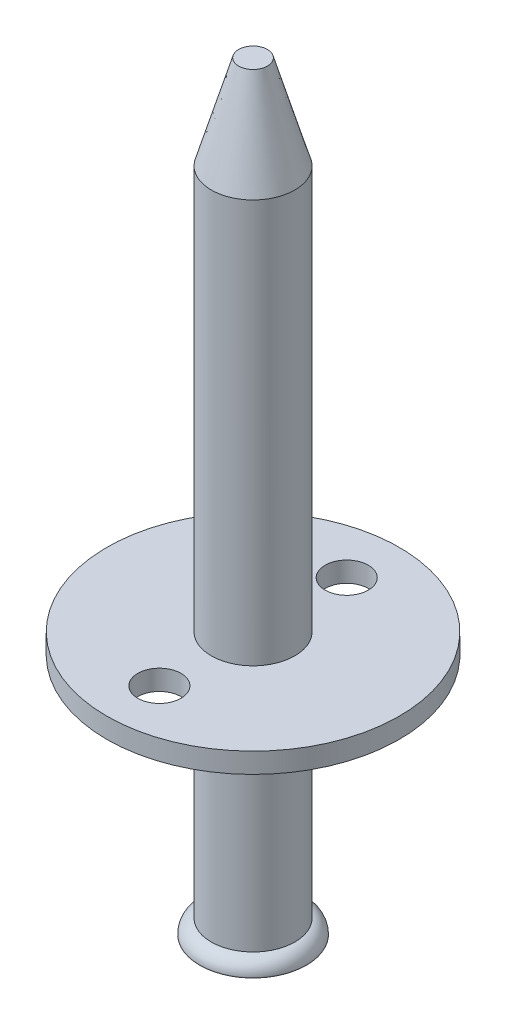
from build123d import *

# Parameters (mm, degrees)
SKETCH1_R           = 2.9
BOSS_EXTRUDE1_DEPTH = 45.2
SKETCH2_R           = 3.7
BOSS_EXTRUDE2_DEPTH = 1
FILLET2_R           = 1
BOSS_EXTRUDE3_DEPTH = 1.4
SKETCH4_R           = 1
SKETCH5_R           = 2.9


with BuildPart() as part:
    # Sketch1 → Boss-Extrude1 (new body)
    with BuildSketch(Plane(origin=(0, 0, 0), x_dir=(1, 0, 0), z_dir=(0, 1, 0))):
        with Locations(Location((0, 0, 0), (0, 0, 270))):
            Circle(SKETCH1_R)
    extrude(amount=BOSS_EXTRUDE1_DEPTH)

    # Sketch2 → Boss-Extrude2 (add)
    with BuildSketch(Plane.XZ):
        with Locations(Location((0, 0, 0), (0, 0, 270))):
            Circle(SKETCH2_R)
    extrude(amount=BOSS_EXTRUDE2_DEPTH)

    # Fillet2
    # the kernel refuses this fillet: 1 mm, written as the material it takes off along each edge
    with BuildSketch(Plane(origin=(0, 0, 0), x_dir=(0, 0, -1), z_dir=(-1, 0, 0))) as fillet2_piece_1:
        with BuildLine():
            CenterArc((2.7, 0.979795897), FILLET2_R, 281.536959033, 78.463040967)
            Line((2.9, 0), (2.904, -0.019595918))
            ThreePointArc((2.904, -0.019595918), (3.3, -0.02), (3.7, -0.02))
            Line((3.7, -0.02), (3.72, 0))
            Line((3.72, 0), (3.72, 0.979795897))
            Line((3.72, 0.979795897), (3.7, 0.979795897))
        make_face()
    revolve(axis=Axis((0, 0, 0), (0, -1, 0)), mode=Mode.SUBTRACT)

    # Sketch3 → Boss-Extrude3 (add)
    with BuildSketch(Plane(origin=(0, 17.2, 0), x_dir=(1, 0, 0), z_dir=(0, 1, 0))):
        with BuildLine():
            ThreePointArc((0, 10.15), (-10.15, 0), (0, -10.15))
            Line((0, -10.15), (0, -8))
            ThreePointArc((0, -8), (-1.5, -6.5), (0, -5))
            Line((0, -5), (0, 5))
            ThreePointArc((0, 5), (-1.5, 6.5), (0, 8))
            Line((0, 8), (0, 10.15))
        make_face()
        with BuildLine():
            Line((0, -8), (0, -10.15))
            ThreePointArc((0, -10.15), (7.177133829, -7.177133829), (10.15, 0))
            ThreePointArc((10.15, 0), (7.177133829, 7.177133829), (0, 10.15))
            Line((0, 10.15), (0, 8))
            ThreePointArc((0, 8), (1.060660172, 7.560660172), (1.5, 6.5))
            ThreePointArc((1.5, 6.5), (1.060660172, 5.439339828), (0, 5))
            Line((0, 5), (0, -5))
            ThreePointArc((0, -5), (1.060660172, -5.439339828), (1.5, -6.5))
            ThreePointArc((1.5, -6.5), (1.060660172, -7.560660172), (0, -8))
        make_face()
    extrude(amount=-BOSS_EXTRUDE3_DEPTH)

    # Sketch4 → Loft1 section 0
    with BuildSketch(Plane(origin=(0, 51.7, 0), x_dir=(1, 0, 0), z_dir=(0, 1, 0))):
        Circle(SKETCH4_R)
    # Sketch5 → Loft1 section 1
    with BuildSketch(Plane(origin=(0, 45.2, 0), x_dir=(1, 0, 0), z_dir=(0, 1, 0))):
        Circle(SKETCH5_R)
    loft()


solid = part.part
